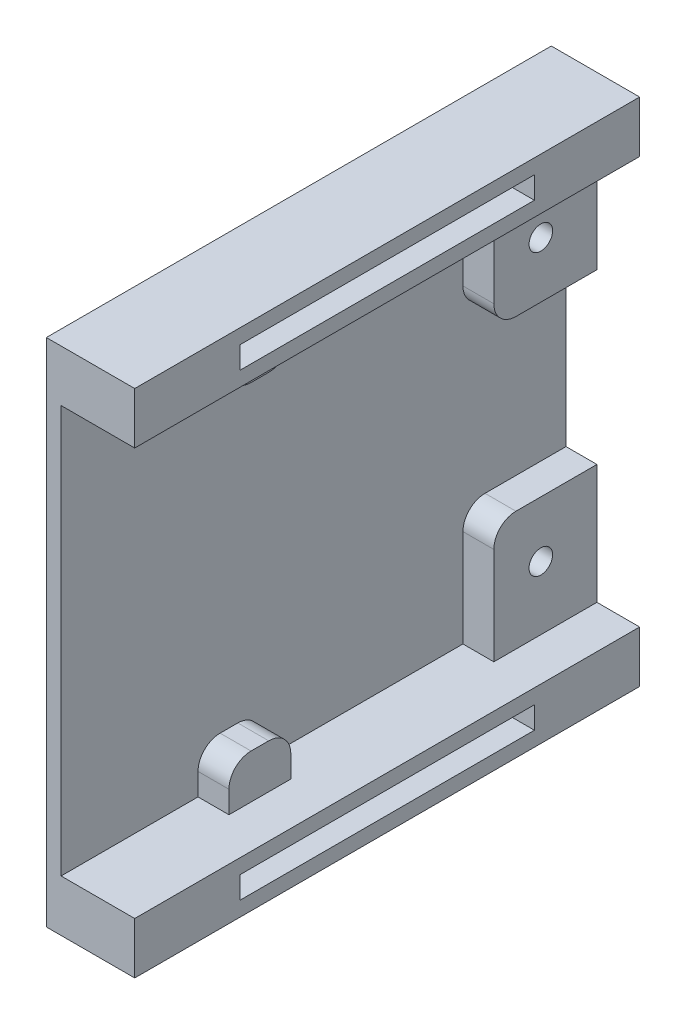
from build123d import *

# Parameters (mm, degrees)
SKETCH1_W               = 34.67
SKETCH1_H               = 34.29
BOSS_EXTRUDE1_DEPTH     = 1
SKETCH3_W               = 3.5
SKETCH3_H               = 34.29
BOSS_EXTRUDE2_DEPTH     = 5
CUT_EXTRUDE1_DEPTH      = 26.108828129
CUT_EXTRUDE1_DEPTH_BACK = 26.108828129
SKETCH5_W               = 1.5
SKETCH5_H               = 20
SKETCH6_W               = 3
SKETCH6_H               = 4.2
SKETCH6_W_2             = 8.11
SKETCH6_H_2             = 7
BOSS_EXTRUDE3_DEPTH     = 2.1
FILLET1_R               = 1.5
CUT_EXTRUDE2_DEPTH      = 25.577698224
CUT_EXTRUDE2_DEPTH_BACK = 25.577698224
SKETCH7_R               = 0.8


with BuildPart() as part:
    # Sketch1 → Boss-Extrude1 (new body)
    with BuildSketch(Plane.YZ):
        Rectangle(SKETCH1_W, SKETCH1_H)
    extrude(amount=BOSS_EXTRUDE1_DEPTH)

    # Sketch3 → Boss-Extrude2 (add)
    with BuildSketch(Plane.YZ.offset(1)):
        with Locations((-15.585, 0)):
            Rectangle(SKETCH3_W, SKETCH3_H)
        with Locations((15.585, 0)):
            Rectangle(SKETCH3_W, SKETCH3_H)
    extrude(amount=BOSS_EXTRUDE2_DEPTH)

    # Sketch5 → Cut-Extrude1 (cut, two sides: drawn at the far end of the back side and taken through both)
    with BuildSketch(Plane.YZ.offset(6).offset(-CUT_EXTRUDE1_DEPTH_BACK)):
        with Locations((-15.585, 0)):
            Rectangle(SKETCH5_W, SKETCH5_H)
        with Locations((15.585, 0)):
            Rectangle(SKETCH5_W, SKETCH5_H)
    extrude(amount=CUT_EXTRUDE1_DEPTH + CUT_EXTRUDE1_DEPTH_BACK, mode=Mode.SUBTRACT)

    # Sketch6 → Boss-Extrude3 (add)
    with BuildSketch(Plane.YZ.offset(1)):
        with Locations((-12.335, 5.745)):
            Rectangle(SKETCH6_W, SKETCH6_H)
        with Locations((-9.78, -13.645)):
            Rectangle(SKETCH6_W_2, SKETCH6_H_2)
        with Locations((9.78, -13.645)):
            Rectangle(SKETCH6_W_2, SKETCH6_H_2)
        with Locations((12.335, 5.745)):
            Rectangle(SKETCH6_W, SKETCH6_H)
    extrude(amount=BOSS_EXTRUDE3_DEPTH)

    # Fillet1
    fillet1_edges = [part.edges().sort_by_distance(p)[0] for p in [
        (2.05, 10.835, 3.645),
        (2.05, 10.835, 7.845),
        (2.05, -10.835, 3.645),
        (2.05, -10.835, 7.845),
        (2.05, 5.725, -10.145),
        (2.05, -5.725, -10.145),
    ]]
    fillet(fillet1_edges, radius=FILLET1_R)

    # Sketch7 → Cut-Extrude2 (cut, two sides: drawn at the far end of the back side and taken through both)
    with BuildSketch(Plane.YZ.offset(3.1).offset(-CUT_EXTRUDE2_DEPTH_BACK)):
        with Locations((-9.525, -13.335)):
            Circle(SKETCH7_R)
        with Locations((9.525, -13.335)):
            Circle(SKETCH7_R)
    extrude(amount=CUT_EXTRUDE2_DEPTH + CUT_EXTRUDE2_DEPTH_BACK, mode=Mode.SUBTRACT)


solid = part.part
